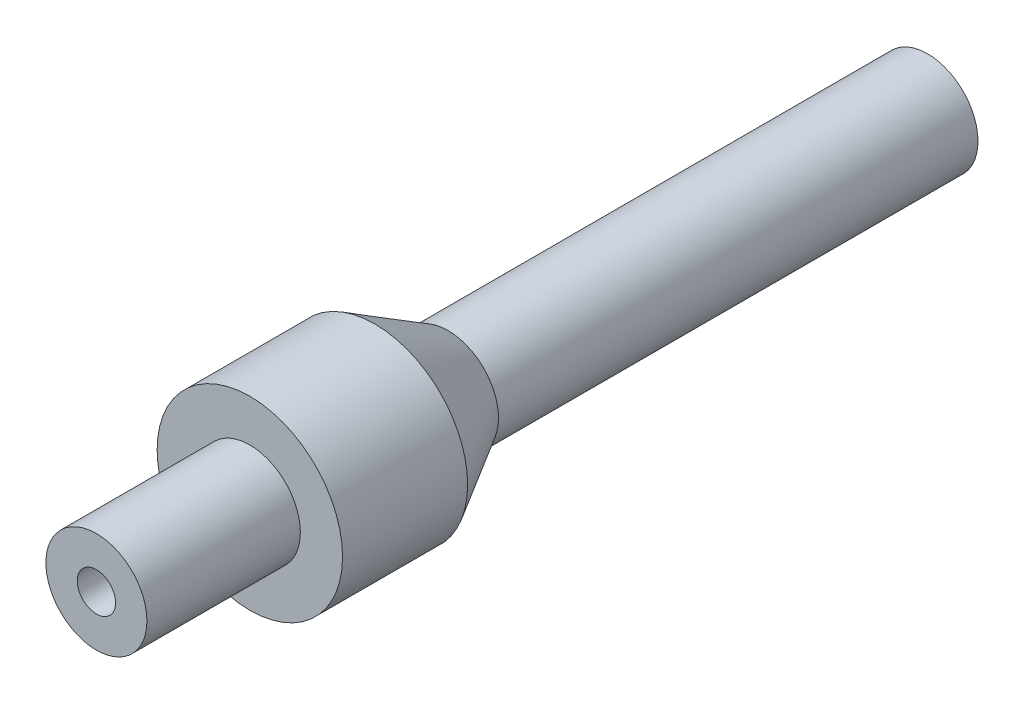
from build123d import *

# Parameters (mm, degrees)
CHAMFER1_SIZE   = 6.062177826
CHAMFER1_SIZE_2 = 10.5


with BuildPart() as part:
    # Sketch2 → Revolve1 (revolve)
    with BuildSketch(Plane(origin=(0, 0, 0), x_dir=(1, 0, 0), z_dir=(0, 1, 0))):
        Polygon((1.5, 0), (3.95, 0), (3.95, 12), (7.25, 12), (7.25, 17), (3.95, 17), (3.95, 65), (1.5, 65), align=None)
    revolve(axis=Axis((0, 0, 0), (0, 0, -1)))

    # Chamfer1
    # the kernel refuses this chamfer: 10.5, 6.062177826 mm, written as the material it adds along each edge
    with BuildSketch(Plane(origin=(0, 0, -17), x_dir=(1, 0, 0), z_dir=(0, 1, 0))) as chamfer1_piece_1_section:
        Polygon((3.95 + CHAMFER1_SIZE, 0), (3.95, CHAMFER1_SIZE_2), (3.95, 0), align=None)
    chamfer1_piece_1 = revolve(axis=Axis((0, 0, -17), (0, 0, -1)), mode=Mode.PRIVATE)
    chamfer1_piece_1 = chamfer1_piece_1 & Plane(origin=(0, 0, -24.775013255), x_dir=(1, 0, 0), z_dir=(0, 0, -1)) * Cylinder(7.25, 42, mode=Mode.PRIVATE)
    add(chamfer1_piece_1)


solid = part.part
